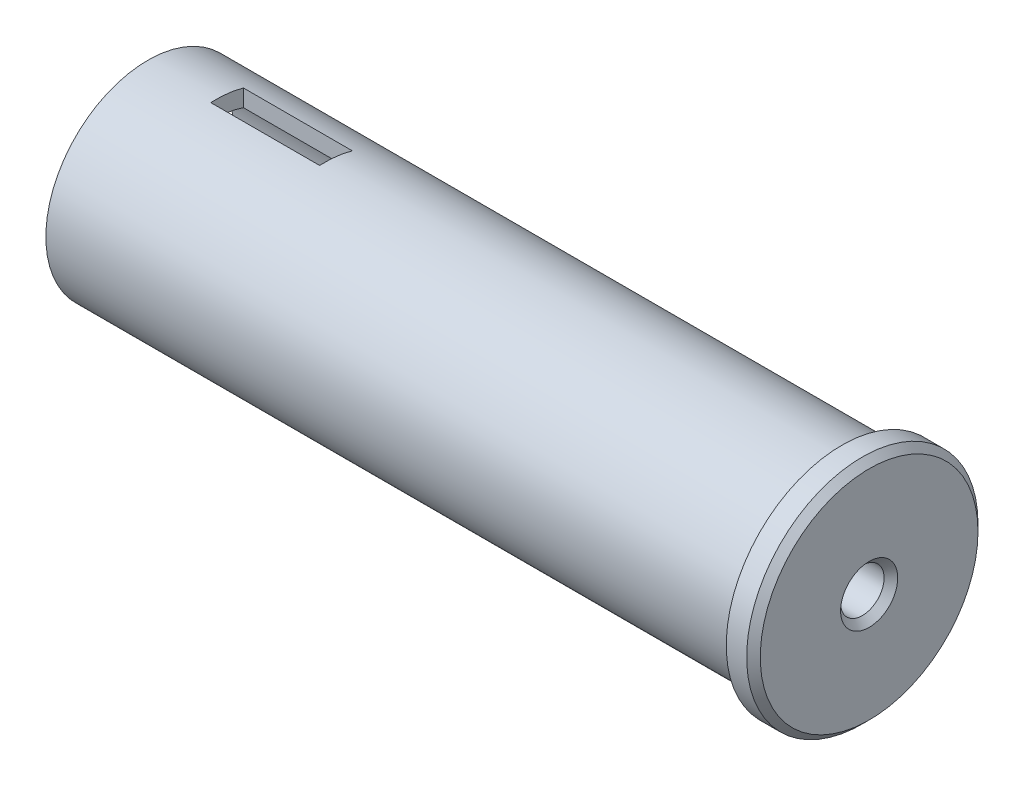
from build123d import *

# Parameters (mm, degrees)
CHAMFER2_SIZE           = 0.5
CUT_EXTRUDE1_DEPTH      = 55.346113016
CUT_EXTRUDE1_DEPTH_BACK = 55.346113016
SKETCH3_W               = 8
SKETCH3_H               = 2.4


with BuildPart() as part:
    # Sketch2 → Revolve1 (revolve)
    with BuildSketch(Plane(origin=(0, 0, 0), x_dir=(1, 0, 0), z_dir=(0, 1, 0))):
        Polygon((0, 1.6), (-11, 1.6), (-11, 6.3), (-53, 6.3), (-53, 7.5), (-2, 7.5), (-2, 8.5), (0, 8.5), align=None)
    revolve(axis=Axis((0, 0, 0), (-1, 0, 0)))

    # Chamfer2
    chamfer2_edges = [part.edges().sort_by_distance(p)[0] for p in [
        (0, 0, 1.6),
        (0, 0, 8.5),
    ]]
    chamfer(chamfer2_edges, length=CHAMFER2_SIZE)

    # Sketch3 → Cut-Extrude1 (cut, two sides: drawn at the far end of the back side and taken through both)
    with BuildSketch(Plane(origin=(0, 0, 0), x_dir=(1, 0, 0), z_dir=(0, 1, 0)).offset(-CUT_EXTRUDE1_DEPTH_BACK)):
        with Locations((-44, 0.817065344)):
            Rectangle(SKETCH3_W, SKETCH3_H)
    extrude(amount=CUT_EXTRUDE1_DEPTH + CUT_EXTRUDE1_DEPTH_BACK, mode=Mode.SUBTRACT)


solid = part.part
